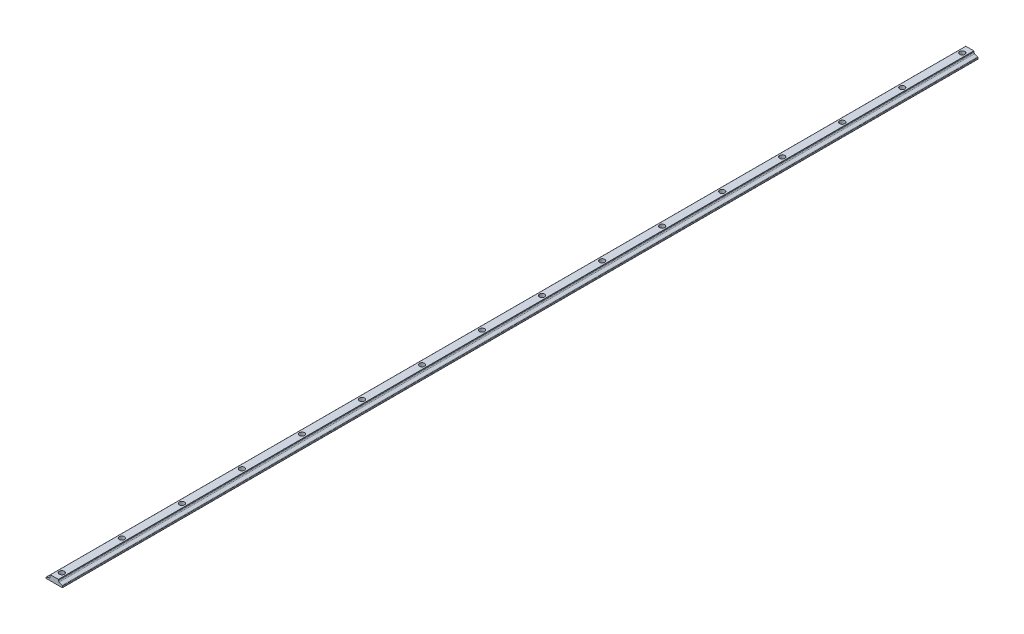
from build123d import *

# Parameters (mm, degrees)
BOSS_EXTRUDE1_START = -387.35
BOSS_EXTRUDE1_DEPTH = 774.7
SKETCH2_R           = 2.1844
CUT_EXTRUDE1_DEPTH  = 388.45632518
LPATTERN1_COUNT     = 16
LPATTERN1_PITCH     = 50.8


# Read off the part's stored shape, not the designer's step: Boss-Extrude1
with BuildPart() as part:
    # Boss-Extrude1 outline → Boss-Extrude1 (new body)
    with BuildSketch(Plane.XY.offset(BOSS_EXTRUDE1_START)):
        with BuildLine():
            Line((7.592213731, -4.356061452), (5.045702304, -3.252351569))
            ThreePointArc((5.045702304, -3.252351569), (4.611794645, -2.88729515), (4.449399788, -2.34399969))
            Line((4.449399788, -2.34399969), (4.449399788, -1.654000019))
            ThreePointArc((4.449399788, -1.654000019), (4.411323664, -1.562076124), (4.319399769, -1.524))
            Line((4.319399769, -1.524), (-2.380600243, -1.524))
            ThreePointArc((-2.380600243, -1.524), (-2.472524138, -1.562076124), (-2.510600262, -1.654000019))
            Line((-2.510600262, -1.654000019), (-2.510600262, -3.254000076))
            ThreePointArc((-2.510600262, -3.254000076), (-2.712136776, -3.852686425), (-3.234691843, -4.207620945))
            Line((-3.234691843, -4.207620945), (-5.727583947, -4.902741098))
            ThreePointArc((-5.727583947, -4.902741098), (-5.996778712, -5.08558597), (-6.100600448, -5.393999841))
            Line((-6.100600448, -5.393999841), (-6.100600448, -5.743999967))
            ThreePointArc((-6.100600448, -5.743999967), (-6.027377074, -5.92077683), (-5.850600211, -5.994000204))
            Line((-5.850600211, -5.994000204), (7.649399763, -5.994000204))
            ThreePointArc((7.649399763, -5.994000204), (7.826176626, -5.92077683), (7.8994, -5.743999967))
            Line((7.8994, -5.743999967), (7.8994, -4.824000488))
            ThreePointArc((7.8994, -4.824000488), (7.81574201, -4.544120895), (7.592213731, -4.356061452))
        make_face()
    extrude(amount=BOSS_EXTRUDE1_DEPTH)

    # Sketch2 → Cut-Extrude1 (cut, through all)
    with BuildSketch(Plane(origin=(0, -1.524, 0), x_dir=(1, 0, 0), z_dir=(0, 1, 0))):
        with Locations(Location((0.9652, -381, 0), (0, 0, 180))):
            Circle(SKETCH2_R)
    cut_extrude1 = extrude(amount=-CUT_EXTRUDE1_DEPTH, mode=Mode.SUBTRACT)

    # LPattern1: Cut-Extrude1 ×16
    with Locations(*[(0, 0, -i * LPATTERN1_PITCH) for i in range(1, LPATTERN1_COUNT)]):
        add(cut_extrude1, mode=Mode.SUBTRACT)


solid = part.part
